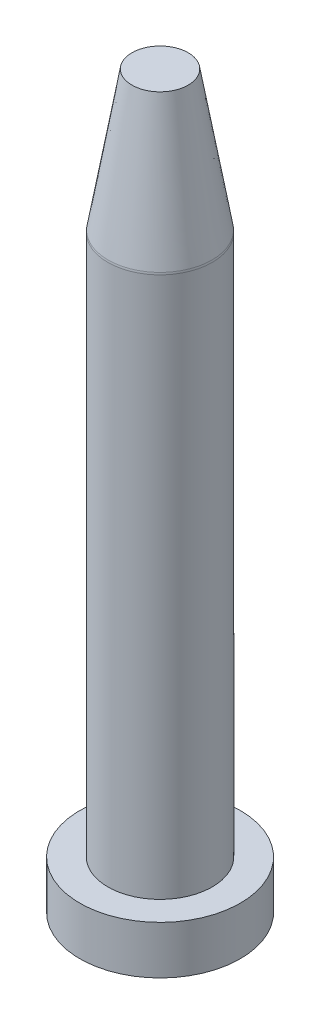
from build123d import *

# Parameters (mm, degrees)
FILLET_1_R = 3


with BuildPart() as part:
    # 草图1 → Revolve 295 (revolve)
    with BuildSketch(Plane.XY):
        Polygon((0, 0), (20, 0), (20, 12), (13, 12), (13, 147), (7, 182), (0, 182), align=None)
    revolve(axis=Axis((0, 0, 0), (0, 1, 0)))

    # 圆角1
    fillet_1_edges = [part.edges().sort_by_distance(p)[0] for p in [
        (-13, 147, 0),
    ]]
    fillet(fillet_1_edges, radius=FILLET_1_R)


solid = part.part
